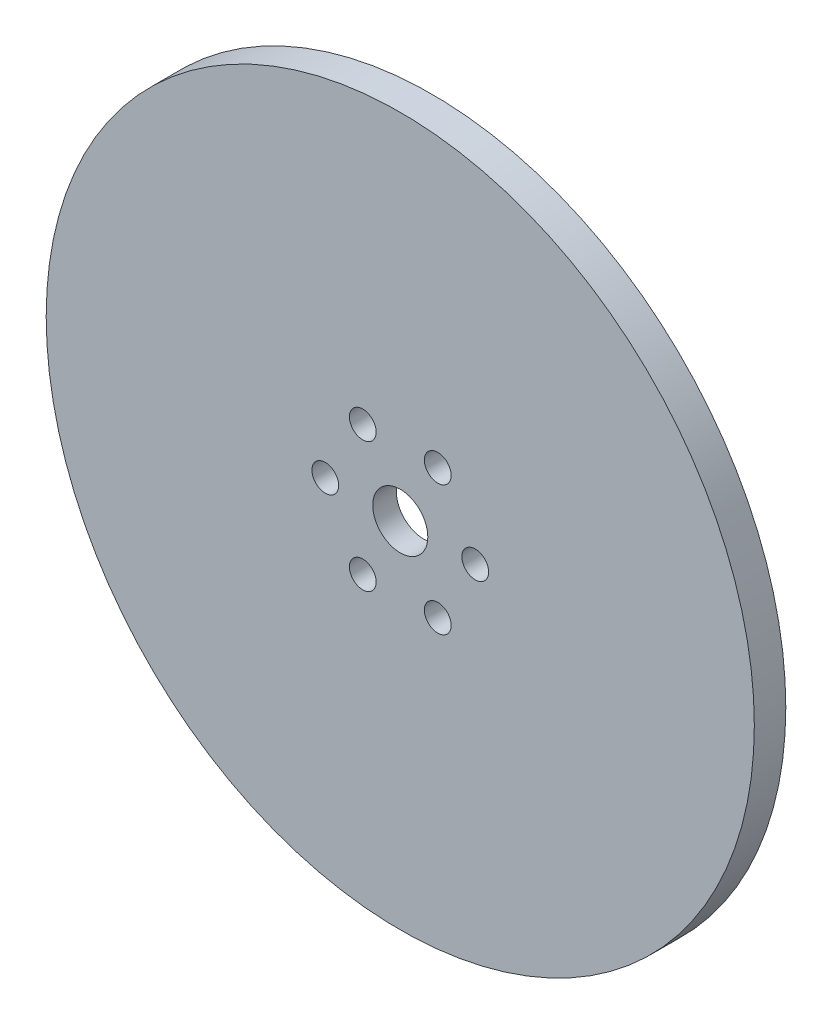
from build123d import *

# Parameters (mm, degrees)
SKETCH4_R          = 1.7
CUT_EXTRUDE1_DEPTH = 10


with BuildPart() as part:
    # Sketch1 → Revolve1 (revolve)
    with BuildSketch(Plane(origin=(0, 0, 0), x_dir=(0, 0, -1), z_dir=(1, 0, 0))):
        Polygon((3, 3.5), (6, 3.5), (6, 25), (7, 25), (7, 45), (3, 45), align=None)
    revolve(axis=Axis((0, 0, 0), (0, 0, -1)))

    # Sketch4 → Cut-Extrude1 (cut)
    with BuildSketch(Plane(origin=(0, 0, -6), x_dir=(-1, 0, 0), z_dir=(0, 0, -1))):
        with Locations((-9.53, 0)):
            Circle(SKETCH4_R)
        with Locations((-4.765, 8.253222098)):
            Circle(SKETCH4_R)
        with Locations((4.765, 8.253222098)):
            Circle(SKETCH4_R)
        with Locations((9.53, 0)):
            Circle(SKETCH4_R)
        with Locations((4.765, -8.253222098)):
            Circle(SKETCH4_R)
        with Locations((-4.765, -8.253222098)):
            Circle(SKETCH4_R)
    extrude(amount=-CUT_EXTRUDE1_DEPTH, mode=Mode.SUBTRACT)


solid = part.part
